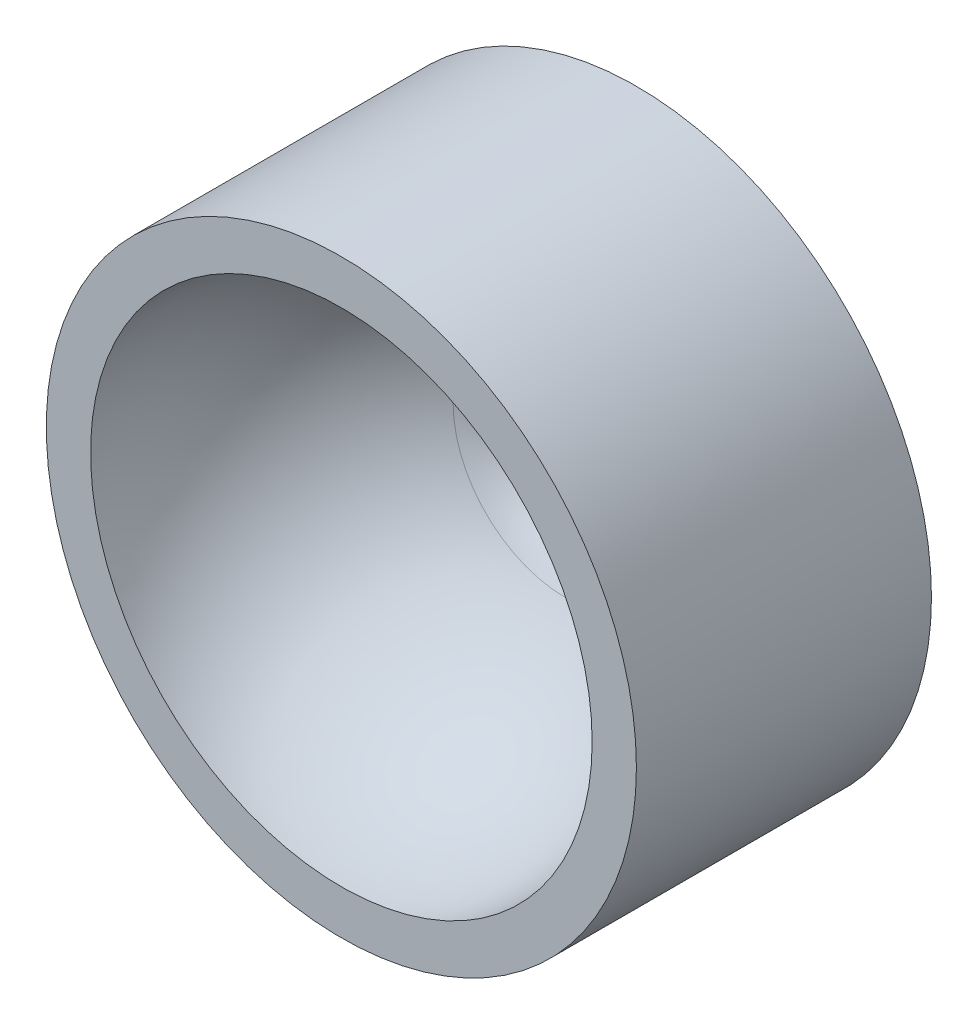
from build123d import *

# Parameters (mm, degrees)
SKETCH1_R           = 10
BOSS_EXTRUDE1_DEPTH = 10
SKETCH3_R           = 1.5
CUT_EXTRUDE1_DEPTH  = 8
FILLET1_R           = 5


with BuildPart() as part:
    # Sketch1 → Boss-Extrude1 (new body)
    with BuildSketch(Plane.XY):
        Circle(SKETCH1_R)
    extrude(amount=BOSS_EXTRUDE1_DEPTH)

    # Sketch2 → Cut-Revolve1 (revolve, cut)
    with BuildSketch(Plane.XY.offset(10)):
        with BuildLine():
            Line((0, 8.5), (0, -8.5))
            ThreePointArc((0, -8.5), (8.5, 0), (0, 8.5))
        make_face()
    revolve(axis=Axis((0, 8.5, 10), (0, -1, 0)), mode=Mode.SUBTRACT)

    # Sketch3 → Cut-Extrude1 (cut)
    with BuildSketch(Plane(origin=(0, 0, 0), x_dir=(-1, 0, 0), z_dir=(0, 0, -1))):
        Circle(SKETCH3_R)
    extrude(amount=-CUT_EXTRUDE1_DEPTH, mode=Mode.SUBTRACT)

    # Fillet1
    # the kernel refuses this fillet: 5 mm, written as the material it takes off along each edge
    with BuildSketch(Plane(origin=(3e-09, 0, 1.633399735), x_dir=(-1, 0, 0), z_dir=(0, -1, 0))) as fillet1_piece_1:
        with BuildLine():
            CenterArc((6.052704826, 3.70049401), FILLET1_R, 204.419783659, 38.942441269)
            Line((3.810962297, -0.768800166), (3.766127446, -0.858186049))
            ThreePointArc((3.766127446, -0.858186049), (2.65159267, -0.396088594), (1.482352944, -0.098430591))
            Line((1.482352944, -0.098430591), (1.400000003, 0))
            ThreePointArc((1.400000003, 0), (1.399999997, 0.816699867), (1.408945901, 1.592057849))
            Line((1.408945901, 1.592057849), (1.499999997, 1.633399735))
        make_face()
    revolve(axis=Axis((3e-09, 0, 1.633399735), (0, 0, -1)), mode=Mode.SUBTRACT)


solid = part.part
